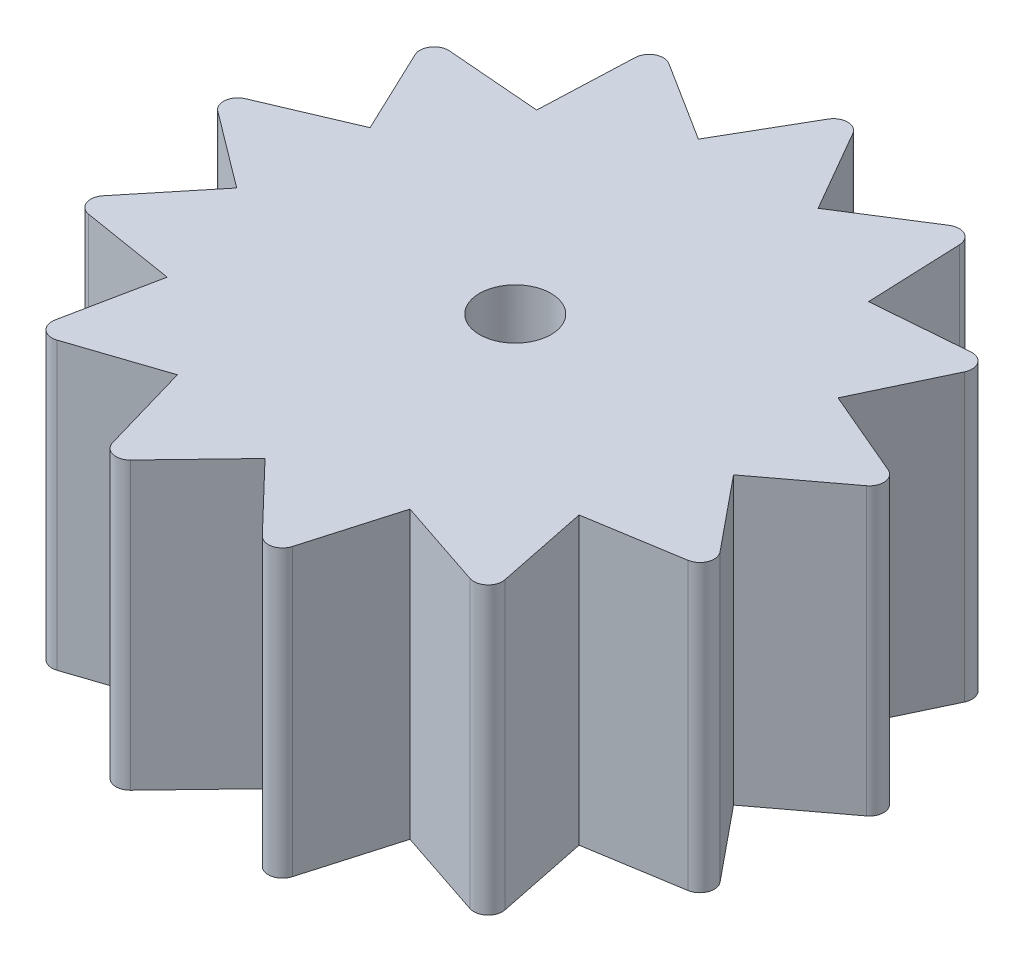
from build123d import *

# Parameters (mm, degrees)
SKETCH1_R           = 0.5
BOSS_EXTRUDE1_DEPTH = 4
CUT_EXTRUDE1_DEPTH  = 3
FILLET1_R           = 0.2


with BuildPart() as part:
    # Sketch1 → Boss-Extrude1 (new body)
    with BuildSketch(Plane(origin=(0, 0, 0), x_dir=(1, 0, 0), z_dir=(0, 1, 0))):
        Polygon((2.320929304, 2.619787619), (3.990706765, 2.754585991), (3.272556849, 1.241117105), (4.813715291, 0.584490857), (3.474481059, -0.421878381), (4.533959656, -1.719504088), (2.880443531, -1.988226614), (3.215528503, -3.629581369), (1.626531102, -3.09909609), (1.160458522, -4.708165299), (0, -3.5), (-1.160458522, -4.708165299), (-1.626531102, -3.09909609), (-3.215528503, -3.629581369), (-2.880443531, -1.988226614), (-4.533959656, -1.719504088), (-3.474481059, -0.421878381), (-4.813715291, 0.584490857), (-3.272556849, 1.241117105), (-3.990706765, 2.754585991), (-2.320929304, 2.619787619), (-2.253475412, 4.293638671), (-0.837604825, 3.398296361), (0, 4.849070475), (0.837604825, 3.398296361), (2.253475412, 4.293638671), align=None)
        Circle(SKETCH1_R, mode=Mode.SUBTRACT)
    extrude(amount=BOSS_EXTRUDE1_DEPTH)

    # Sketch2 → Cut-Extrude1 (cut)
    with BuildSketch(Plane.XZ):
        Polygon((-2.356515562, -0.355187571), (-2.394012407, -0.73845503), (-2.147128813, -1.03400274), (-2.069989712, -1.411295089), (-1.746960246, -1.620942227), (-1.562039347, -1.958735387), (-1.191566595, -2.063853884), (-0.915294931, -2.332133449), (-0.530297023, -2.323383066), (-0.187222544, -2.49831122), (0.178091766, -2.376469467), (0.557485388, -2.442503076), (0.870656321, -2.218396127), (1.252658297, -2.169667815), (1.485859241, -1.863208555), (1.836527019, -1.704048047), (1.969037046, -1.342466727), (2.257212255, -1.087016131), (2.27725727, -0.702440839), (2.477334277, -0.373398063), (2.383133191, 0), (2.477334277, 0.373398063), (2.27725727, 0.702440839), (2.257212255, 1.087016131), (1.969037046, 1.342466727), (1.836527019, 1.704048047), (1.485859241, 1.863208555), (1.252658297, 2.169667815), (0.870656321, 2.218396127), (0.557485388, 2.442503076), (0.178091766, 2.376469467), (-0.187222544, 2.49831122), (-0.530297023, 2.323383066), (-0.915294931, 2.332133449), (-1.191566595, 2.063853884), (-1.562039347, 1.958735387), (-1.746960246, 1.620942227), (-2.069989712, 1.411295089), (-2.147128813, 1.03400274), (-2.394012407, 0.73845503), (-2.356515562, 0.355187571), (-2.505316594, 0), align=None)
    extrude(amount=-CUT_EXTRUDE1_DEPTH, mode=Mode.SUBTRACT)

    # Fillet1
    fillet1_edges = [part.edges().sort_by_distance(p)[0] for p in [
        (-4.813715291, 2, -0.584490857),
        (-4.533959656, 2, 1.719504088),
        (-3.215528503, 2, 3.629581369),
        (-1.160458522, 2, 4.708165299),
        (1.160458522, 2, 4.708165299),
        (3.215528503, 2, 3.629581369),
        (4.533959656, 2, 1.719504088),
        (4.813715291, 2, -0.584490857),
        (3.990706765, 2, -2.754585991),
        (2.253475412, 2, -4.293638671),
        (0, 2, -4.849070475),
        (-2.253475412, 2, -4.293638671),
        (-3.990706765, 2, -2.754585991),
    ]]
    fillet(fillet1_edges, radius=FILLET1_R)


solid = part.part
